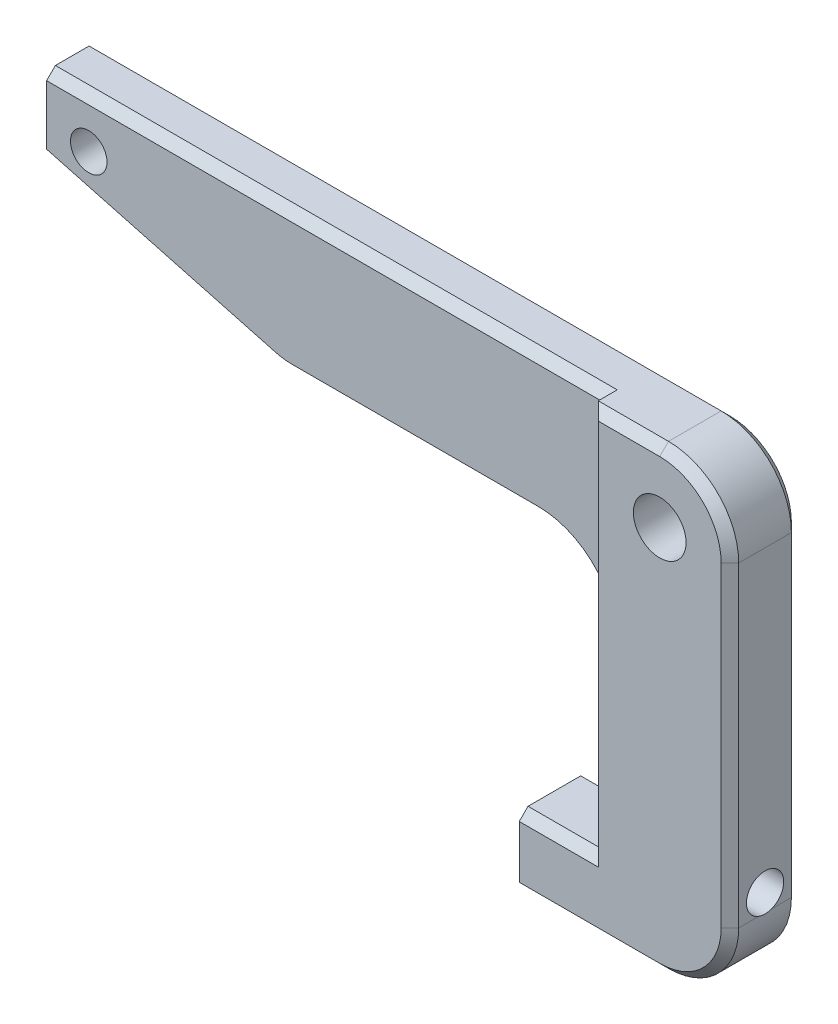
from build123d import *

# Parameters (mm, degrees)
BASE_EXTRUDE_DEPTH = 12.7
SKETCH2_R          = 4.7625
CUT_EXTRUDE1_DEPTH = 135.554087638
SKETCH3_R          = 3.302
CUT_EXTRUDE2_DEPTH = 106.159296474
CHAMFER1_SIZE      = 11.43
CHAMFER1_SIZE2     = 42.657340731
SKETCH5_W          = 101.6
SKETCH5_H          = 25.4
CUT_EXTRUDE4_DEPTH = 3.429
FILLET2_R          = 12.7
CHAMFER2_SIZE      = 1.5875
CHAMFER3_SIZE      = 1.5875
SKETCH8_R          = 9.525
CUT_EXTRUDE5_DEPTH = 4.7752


with BuildPart() as part:
    # Sketch1 → Base-Extrude (new body)
    with BuildSketch(Plane.XY):
        Polygon((-114.3, 12.7), (-114.3, -12.7), (-12.7, -12.7), (-12.7, -57.15), (-25.4, -57.15), (-25.4, -69.85), (12.7, -69.85), (12.7, 12.7), align=None)
    extrude(amount=BASE_EXTRUDE_DEPTH)

    # Sketch2 → Cut-Extrude1 (cut, through all)
    with BuildSketch(Plane.XY.offset(12.7)):
        Circle(SKETCH2_R)
    extrude(amount=-CUT_EXTRUDE1_DEPTH, mode=Mode.SUBTRACT)

    # Sketch3 → Cut-Extrude2 (cut, through all)
    with BuildSketch(Plane(origin=(-40.826123223, 4.303739396, 12.7), x_dir=(1, 0, 0), z_dir=(0, 0, 1))):
        with Locations((-65.853876777, -0.493739396)):
            Circle(SKETCH3_R)
    extrude(amount=-CUT_EXTRUDE2_DEPTH, mode=Mode.SUBTRACT)

    # Chamfer1
    chamfer1_edges = [part.edges().sort_by_distance(p)[0] for p in [
        (-114.3, -12.7, 6.35),
    ]]
    chamfer1_side = [part.faces().sort_by_distance(p)[0] for p in [
        (-114.3, 0, 6.35),
    ]]
    chamfer(chamfer1_edges, length=CHAMFER1_SIZE, length2=CHAMFER1_SIZE2, reference=chamfer1_side[0])

    # Sketch5 → Cut-Extrude4 (cut)
    with BuildSketch(Plane(origin=(-65.557986772, -0.200650606, 12.7), x_dir=(1, 0, 0), z_dir=(0, 0, 1))):
        with Locations((2.057986772, 0.200650606)):
            Rectangle(SKETCH5_W, SKETCH5_H)
    extrude(amount=-CUT_EXTRUDE4_DEPTH, mode=Mode.SUBTRACT)

    # Sketch7 → Hole1 (revolve, cut)
    with BuildSketch(Plane(origin=(12.7, -53.975, 6.35), x_dir=(0, 0, -1), z_dir=(0, 1, 0))):
        Polygon((0, 0), (0, 127), (2.108198174, 127), (2.108198174, 126.997460002), (2.108198174, 12.699989143), (2.740657626, 12.699989), (3.373117078, 12.699989), (3.373117078, 6.3499945), (3.373117078, 0), align=None)
    revolve(axis=Axis((12.7, -53.975, 6.35), (-1, 0, 0)), mode=Mode.SUBTRACT)

    # Fillet2
    # the kernel refuses this fillet: 12.7 mm, written as the material it adds along each edge
    with BuildSketch(Plane(origin=(-12.7, -12.7, 0), x_dir=(-1, 0, 0), z_dir=(0, 0, 1))) as fillet2_piece_1:
        with BuildLine():
            CenterArc((FILLET2_R, FILLET2_R), FILLET2_R, 180, 90)
            Line((0, FILLET2_R), (0, 0))
            Line((0, 0), (FILLET2_R, 0))
        make_face()
    extrude(amount=9.271)
    # the kernel refuses this fillet: 12.7 mm, written as the material it takes off along each edge
    with BuildSketch(Plane(origin=(12.7, 12.7, -31.75), x_dir=(0, -1, 0), z_dir=(0, 0, 1))) as fillet2_2_piece_1:
        with BuildLine():
            CenterArc((FILLET2_R, -FILLET2_R), FILLET2_R, 90, 90)
            Line((0, -FILLET2_R), (0, 0))
            Line((0, 0), (FILLET2_R, 0))
        make_face()
    extrude(amount=76.2, mode=Mode.SUBTRACT)
    with BuildSketch(Plane(origin=(12.7, -69.85, -31.75), x_dir=(0, 1, 0), z_dir=(0, 0, 1))) as fillet2_2_piece_2:
        with BuildLine():
            CenterArc((FILLET2_R, FILLET2_R), FILLET2_R, 180, 90)
            Line((0, FILLET2_R), (0, 0))
            Line((0, 0), (FILLET2_R, 0))
        make_face()
    extrude(amount=76.2, mode=Mode.SUBTRACT)
    with BuildSketch(Plane(origin=(-71.642659269, -12.7, -4.179966798), x_dir=(1, 0, 0), z_dir=(0, 0, 1))) as fillet2_2_piece_3:
        with BuildLine():
            CenterArc((FILLET2_R * 0.131652497587, FILLET2_R), FILLET2_R, 255, 15)
            Line((-FILLET2_R * 0.127166547515, FILLET2_R * 0.0340741737109), (0, 0))
            Line((0, 0), (FILLET2_R * 0.131652497587, 0))
        make_face()
    extrude(amount=17.630933597, mode=Mode.SUBTRACT)

    # Chamfer2
    chamfer2_edges = [part.edges().sort_by_distance(p)[0] for p in [
        (-57.15, 12.7, 0),
        (12.7, -28.575, 0),
        (-12.7, -69.85, 0),
        (8.980256121, -66.130256121, 0),
        (8.980256121, 8.980256121, 0),
    ]]
    chamfer(chamfer2_edges, length=CHAMFER2_SIZE)

    # Chamfer3
    chamfer3_edges = [part.edges().sort_by_distance(p)[0] for p in [
        (-19.05, -57.15, 0),
    ]]
    chamfer(chamfer3_edges, length=CHAMFER3_SIZE)
    chamfer3_2_edges = [part.edges().sort_by_distance(p)[0] for p in [
        (-12.7, -41.275, 0),
        (-16.419743879, -16.419743879, 0),
        (-47.685336275, -12.7, 0),
        (-71.628355191, -12.591349739, 0),
        (-93.778837211, -6.768628997, 0),
    ]]
    chamfer(chamfer3_2_edges, length=CHAMFER3_SIZE)
    chamfer3_3_edges = [part.edges().sort_by_distance(p)[0] for p in [
        (-19.05, -57.15, 12.7),
    ]]
    chamfer(chamfer3_3_edges, length=CHAMFER3_SIZE)
    chamfer3_4_edges = [part.edges().sort_by_distance(p)[0] for p in [
        (-12.7, -22.225, 12.7),
    ]]
    chamfer(chamfer3_4_edges, length=CHAMFER3_SIZE)
    chamfer3_5_edges = [part.edges().sort_by_distance(p)[0] for p in [
        (-16.419743879, -16.419743879, 9.271),
        (-47.685336275, -12.7, 9.271),
        (-71.628355191, -12.591349739, 9.271),
        (-93.778837211, -6.768628997, 9.271),
    ]]
    chamfer(chamfer3_5_edges, length=CHAMFER3_SIZE)
    chamfer3_6_edges = [part.edges().sort_by_distance(p)[0] for p in [
        (-12.7, -69.85, 12.7),
        (8.980256121, 8.980256121, 12.7),
        (12.7, -28.575, 12.7),
        (8.980256121, -66.130256121, 12.7),
        (-5.55625, 12.7, 12.7),
    ]]
    chamfer(chamfer3_6_edges, length=CHAMFER3_SIZE)
    chamfer3_7_edges = [part.edges().sort_by_distance(p)[0] for p in [
        (-63.5, 12.7, 9.271),
    ]]
    chamfer(chamfer3_7_edges, length=CHAMFER3_SIZE)

    # Sketch8 → Cut-Extrude5 (cut)
    with BuildSketch(Plane(origin=(0, 0, 0), x_dir=(-1, 0, 0), z_dir=(0, 0, -1))):
        Circle(SKETCH8_R)
    extrude(amount=-CUT_EXTRUDE5_DEPTH, mode=Mode.SUBTRACT)


solid = part.part
